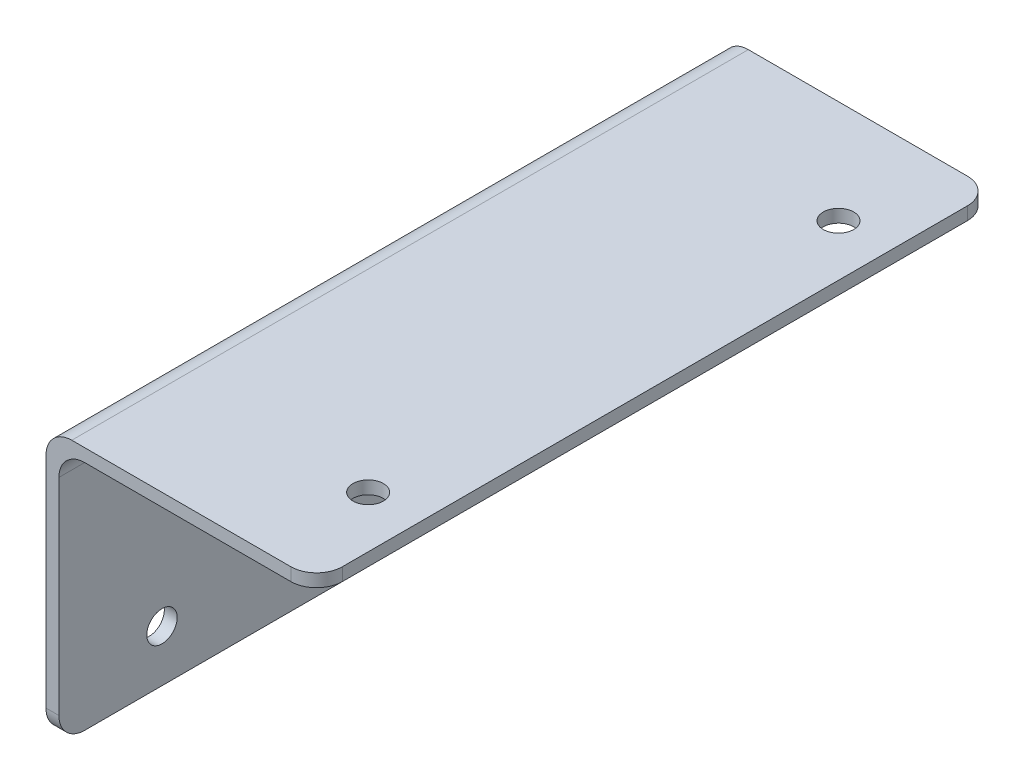
from build123d import *

# Parameters (mm, degrees)
BOSS_EXTRUDE1_DEPTH = 66.675
SKETCH3_R           = 1.499997
CUT_EXTRUDE1_DEPTH  = 77.603742892
SKETCH6_R           = 1.499997
CUT_EXTRUDE2_DEPTH  = 77.170890273
FILLET1_R           = 2.54
FILLET2_R           = 2.54


with BuildPart() as part:
    # Sketch2 → Boss-Extrude1 (new body)
    with BuildSketch(Plane.XY):
        Polygon((0, 0), (-1.27, 0), (-1.27, 26.67), (25.4, 26.67), (25.4, 25.4), (0, 25.4), align=None)
    extrude(amount=BOSS_EXTRUDE1_DEPTH)

    # Sketch3 → Cut-Extrude1 (cut, through all)
    with BuildSketch(Plane.ZY.offset(1.27)):
        with Locations((10.16, 5.08)):
            Circle(SKETCH3_R)
        with Locations((56.515, 5.08)):
            Circle(SKETCH3_R)
    extrude(amount=-CUT_EXTRUDE1_DEPTH, mode=Mode.SUBTRACT)

    # Sketch6 → Cut-Extrude2 (cut, through all)
    with BuildSketch(Plane(origin=(0, 26.67, 0), x_dir=(1, 0, 0), z_dir=(0, 1, 0))):
        with Locations((20.32, -10.16)):
            Circle(SKETCH6_R)
        with Locations((20.32, -56.515)):
            Circle(SKETCH6_R)
    extrude(amount=-CUT_EXTRUDE2_DEPTH, mode=Mode.SUBTRACT)

    # Fillet1
    fillet1_edges = [part.edges().sort_by_distance(p)[0] for p in [
        (25.4, 26.035, 0),
        (-0.635, 0, 0),
        (-0.635, 0, 66.675),
        (25.4, 26.035, 66.675),
    ]]
    fillet(fillet1_edges, radius=FILLET1_R)

    # Fillet2
    fillet2_edges = [part.edges().sort_by_distance(p)[0] for p in [
        (0, 25.4, 33.3375),
        (-1.27, 26.67, 33.3375),
    ]]
    fillet(fillet2_edges, radius=FILLET2_R)


solid = part.part
